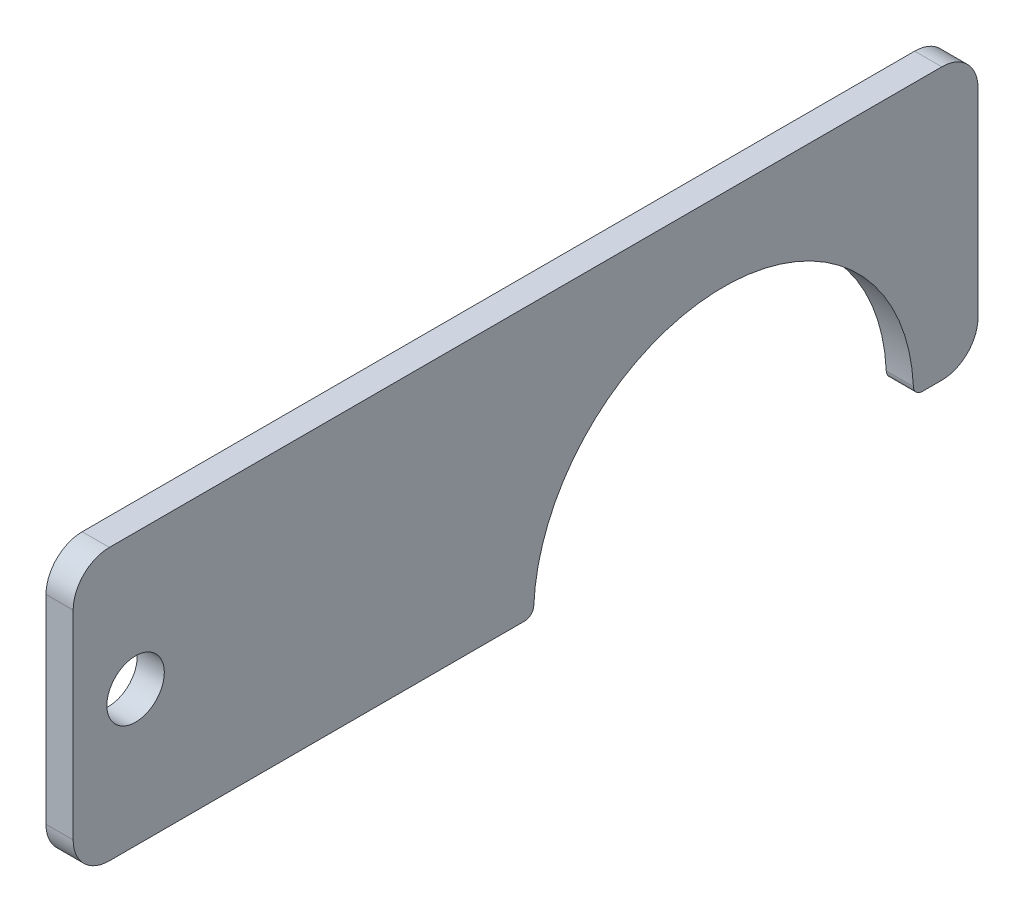
from build123d import *

# Parameters (mm, degrees)
BOSS_EXTRUDE1_DEPTH = 3
SKETCH2_R           = 3.175
CUT_EXTRUDE1_DEPTH  = 105.446158378
FILLET1_R           = 4
FILLET2_R           = 1


with BuildPart() as part:
    # Sketch1 → Boss-Extrude1 (new body)
    with BuildSketch(Plane(origin=(0, 0, 0), x_dir=(0, 0, -1), z_dir=(1, 0, 0))):
        with BuildLine():
            Line((0, 0), (100, 0))
            Line((100, 0), (100, -30))
            Line((100, -30), (92.883246032, -30))
            ThreePointArc((92.883246032, -30), (71.883246032, -9), (50.883246032, -30))
            Line((50.883246032, -30), (0, -30))
            Line((0, -30), (0, 0))
        make_face()
    extrude(amount=BOSS_EXTRUDE1_DEPTH)

    # Sketch2 → Cut-Extrude1 (cut, through all)
    with BuildSketch(Plane(origin=(3, 0, 0), x_dir=(0, 0, -1), z_dir=(1, 0, 0))):
        with Locations((6.900903962, -15)):
            Circle(SKETCH2_R)
    extrude(amount=-CUT_EXTRUDE1_DEPTH, mode=Mode.SUBTRACT)

    # Fillet1
    fillet1_edges = [part.edges().sort_by_distance(p)[0] for p in [
        (1.5, -30, 0),
        (1.5, 0, 0),
        (1.5, -30, -100),
        (1.5, 0, -100),
    ]]
    fillet(fillet1_edges, radius=FILLET1_R)

    # Fillet2
    fillet2_edges = [part.edges().sort_by_distance(p)[0] for p in [
        (1.5, -30, -50.883246032),
        (1.5, -30, -92.883246032),
    ]]
    fillet(fillet2_edges, radius=FILLET2_R)


solid = part.part
